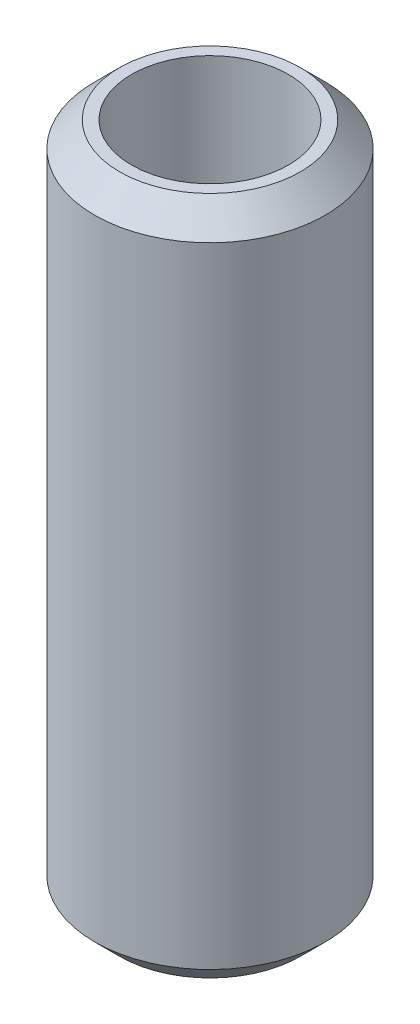
from build123d import *

# Parameters (mm, degrees)
SKETCH1_R           = 25
BOSS_EXTRUDE1_DEPTH = 147.222688113
SKETCH2_R           = 17.014514558
CUT_EXTRUDE1_DEPTH  = 152.408453843
CHAMFER1_SIZE       = 5.419405074


with BuildPart() as part:
    # Sketch1 → Boss-Extrude1 (new body)
    with BuildSketch(Plane(origin=(0, 0, 0), x_dir=(1, 0, 0), z_dir=(0, 1, 0))):
        Circle(SKETCH1_R)
    extrude(amount=BOSS_EXTRUDE1_DEPTH)

    # Sketch2 → Cut-Extrude1 (cut, through all)
    with BuildSketch(Plane(origin=(0, 0, 0), x_dir=(1, 0, 0), z_dir=(0, 1, 0))):
        Circle(SKETCH2_R)
    extrude(amount=CUT_EXTRUDE1_DEPTH, mode=Mode.SUBTRACT)

    # Chamfer1
    chamfer1_edges = [part.edges().sort_by_distance(p)[0] for p in [
        (-25, 147.222688113, 0),
        (-25, 0, 0),
    ]]
    chamfer(chamfer1_edges, length=CHAMFER1_SIZE)


solid = part.part
